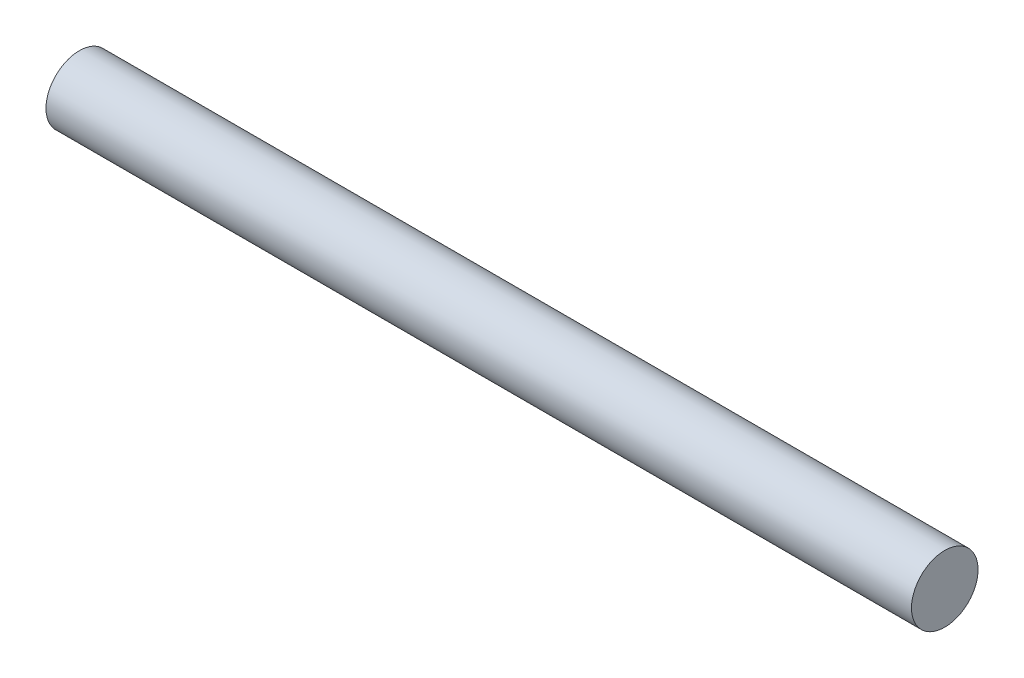
from build123d import *


with BuildPart() as part:
    # ｽｹｯﾁ1 → 回転1 (revolve)
    with BuildSketch(Plane.XY):
        Polygon((0, 0), (0, 3), (35, 3), (36, 3), (39, 3), (39, 0), align=None)
    revolve(axis=Axis((0, 0, 0), (1, 0, 0)))

    # ﾐﾗｰ1: part across plane


with BuildPart() as part_1:
    add(part.part)
    add(part.part.mirror(Plane(origin=(0, 0, 0), x_dir=(0, 0, 1), z_dir=(1, 0, 0))))


solid = part_1.part
